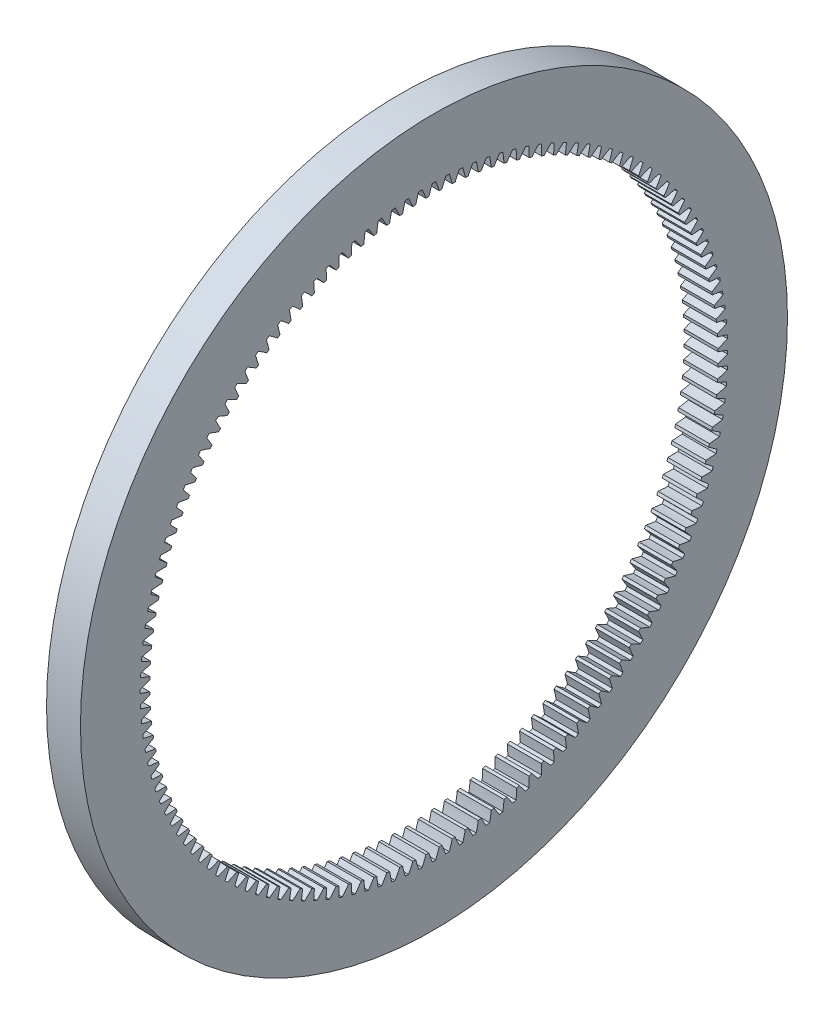
from build123d import *

# Parameters (mm, degrees)
BASPROSKE_W     = 12
BASPROSKE_H     = 24.5
TOOTHCUT_DEPTH  = 178.183520678
TEETHCUTS_COUNT = 136
TEETHCUTS_ANGLE = 357.352941176


with BuildPart() as part:
    # BasProSke → Base-Revolve (revolve)
    with BuildSketch(Plane(origin=(0, 0, 0), x_dir=(1, 0, 0), z_dir=(0, 1, 0))):
        with Locations((6, 112.75)):
            Rectangle(BASPROSKE_W, BASPROSKE_H)
    revolve(axis=Axis((-10, 0, 0), (1, 0, 0)))

    # TooCutSke → ToothCut (cut, through all)
    with BuildSketch(Plane(origin=(0, 0, 0), x_dir=(0, 0, -1), z_dir=(1, 0, 0))):
        with BuildLine():
            ThreePointArc((1.818014225, 100.458150836), (1.245578034, 102.176879792), (0.612462342, 103.874194417))
            ThreePointArc((0.612462342, 103.874194417), (0, 103.876), (-0.612462342, 103.874194417))
            ThreePointArc((-0.612462342, 103.874194417), (-1.245578034, 102.176879792), (-1.818014225, 100.458150836))
            ThreePointArc((-1.818014225, 100.458150836), (0, 100.4746), (1.818014225, 100.458150836))
        make_face()
    toothcut = extrude(amount=TOOTHCUT_DEPTH, mode=Mode.SUBTRACT)

    # TeethCuts: ToothCut ×136 about axis
    teethcuts_axis = Axis((-10, 0, 0), (1, 0, 0))
    for i in range(1, TEETHCUTS_COUNT):
        add(toothcut.rotate(teethcuts_axis, i * TEETHCUTS_ANGLE / (TEETHCUTS_COUNT - 1)), mode=Mode.SUBTRACT)


solid = part.part
